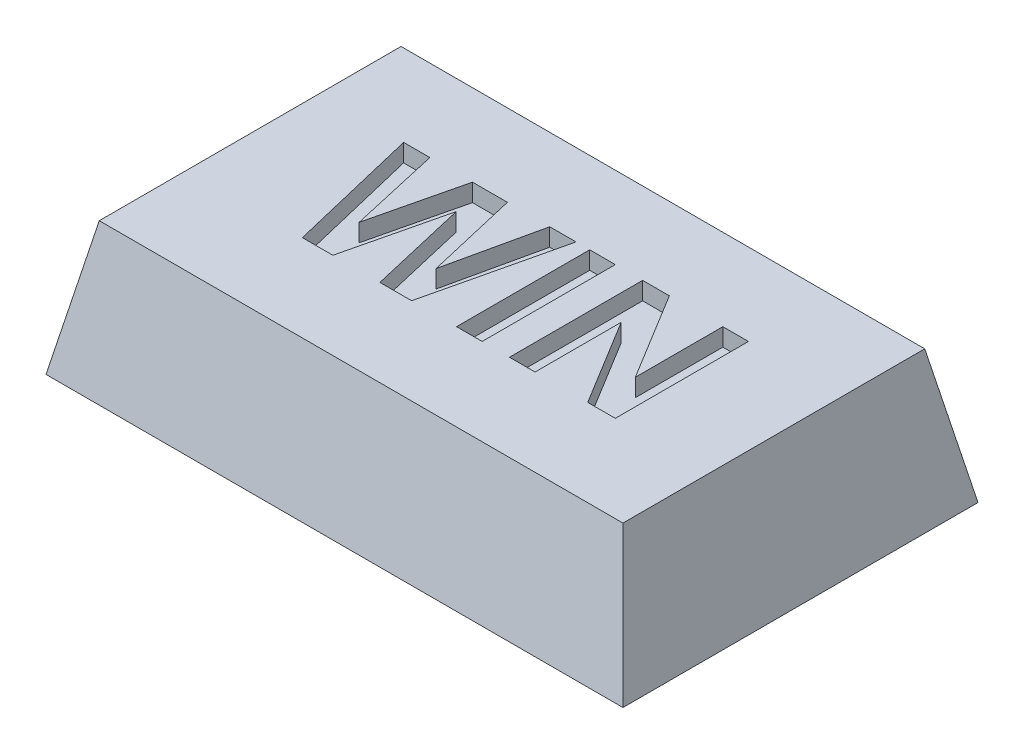
from build123d import *

# Parameters (mm, degrees)
SKETCH1_W               = 13
SKETCH1_H               = 8
BOSS_EXTRUDE1_DEPTH     = 3
CUT_EXTRUDE1_DEPTH      = 16.556349186
CUT_EXTRUDE1_DEPTH_BACK = 16.556349186
CUT_EXTRUDE2_DEPTH      = 16.556349186
CUT_EXTRUDE2_DEPTH_BACK = 16.556349186
SKETCH4_R               = 1.8
CUT_EXTRUDE3_DEPTH      = 0.8
SKETCH5_W               = 8
SKETCH5_H               = 1
BOSS_EXTRUDE2_DEPTH     = 2
FILLET1_R               = 4
SKETCH6_W               = 0.576923077
SKETCH6_H               = 3
CUT_EXTRUDE4_DEPTH      = 0.4


with BuildPart() as part:
    # Sketch1 → Boss-Extrude1 (new body)
    with BuildSketch(Plane(origin=(0, 0, 0), x_dir=(1, 0, 0), z_dir=(0, 1, 0))):
        with Locations((6.5, 4)):
            Rectangle(SKETCH1_W, SKETCH1_H)
    extrude(amount=BOSS_EXTRUDE1_DEPTH)

    # Sketch2 → Cut-Extrude1 (cut, two sides: drawn at the far end of the back side and taken through both)
    with BuildSketch(Plane.XY.offset(-CUT_EXTRUDE1_DEPTH_BACK)):
        Polygon((0, 0), (0.6, 3), (0, 3), align=None)
        Polygon((13, 0), (12.4, 3), (13, 3), align=None)
    extrude(amount=CUT_EXTRUDE1_DEPTH + CUT_EXTRUDE1_DEPTH_BACK, mode=Mode.SUBTRACT)

    # Sketch3 → Cut-Extrude2 (cut, two sides: drawn at the far end of the back side and taken through both)
    with BuildSketch(Plane(origin=(0, 0, 0), x_dir=(0, 0, -1), z_dir=(1, 0, 0)).offset(-CUT_EXTRUDE2_DEPTH_BACK)):
        Polygon((0, 0), (0.6, 3), (0, 3), align=None)
        Polygon((8, 3), (7.4, 3), (8, 0), align=None)
    extrude(amount=CUT_EXTRUDE2_DEPTH + CUT_EXTRUDE2_DEPTH_BACK, mode=Mode.SUBTRACT)

    # Sketch4 → Cut-Extrude3 (cut)
    with BuildSketch(Plane.XZ):
        with Locations(Location((6.50000125, -3.75, 0), (0, 0, 270))):
            Circle(SKETCH4_R)
    extrude(amount=-CUT_EXTRUDE3_DEPTH, mode=Mode.SUBTRACT)

    # Sketch5 → Boss-Extrude2 (add)
    with BuildSketch(Plane.XZ):
        with Locations((6.500011, -7.5)):
            Rectangle(SKETCH5_W, SKETCH5_H)
    extrude(amount=BOSS_EXTRUDE2_DEPTH)

    # Fillet1
    # the kernel refuses this fillet: 4 mm, written as the material it takes off along each edge
    with BuildSketch(Plane(origin=(10.500011, -2, -16.660254038), x_dir=(0, 1, 0), z_dir=(0, 0, 1)), Plane(origin=(2.500011, -2, 1.660254038), x_dir=(0, 1, 0), z_dir=(0, 0, -1))) as fillet1_piece_1:
        with BuildLine():
            CenterArc((4, 3.464101615), FILLET1_R, 180, 60)
            Line((0, 3.464101615), (-0.08, 3.464101615))
            Line((-0.08, 3.464101615), (-0.08, 0))
            Line((-0.08, 0), (0, -0.08))
            ThreePointArc((0, -0.08), (1, -0.08), (1.96, -0.069282032))
            Line((1.96, -0.069282032), (2, 0))
        make_face()
    extrude(amount=18.320508076, mode=Mode.SUBTRACT)

    # Sketch6 → Cut-Extrude4 (cut)
    with BuildSketch(Plane(origin=(0, 3, 0), x_dir=(1, 0, 0), z_dir=(0, 1, 0))):
        Polygon((3.219165588, 2.557267472), (2.50101655, 5.557267472), (3.092362704, 5.557267472), (3.558708858, 3.496570357), (4.052098281, 5.557267472), (4.839357896, 5.557267472), (5.327939627, 3.461714587), (5.793083858, 5.557267472), (6.385631934, 5.557267472), (5.68070405, 2.557267472), (4.966160781, 2.557267472), (4.443324242, 4.800055934), (3.906665588, 2.557267472), align=None)
        with Locations((6.981785781, 4.057267472)):
            Rectangle(SKETCH6_W, SKETCH6_H)
        Polygon((7.885631934, 2.557267472), (7.885631934, 5.557267472), (8.488396358, 5.557267472), (9.693324242, 3.584911703), (9.693324242, 5.557267472), (10.270247319, 5.557267472), (10.270247319, 2.557267472), (9.648853088, 2.557267472), (8.462555011, 4.498373241), (8.462555011, 2.557267472), align=None)
    extrude(amount=-CUT_EXTRUDE4_DEPTH, mode=Mode.SUBTRACT)


solid = part.part
